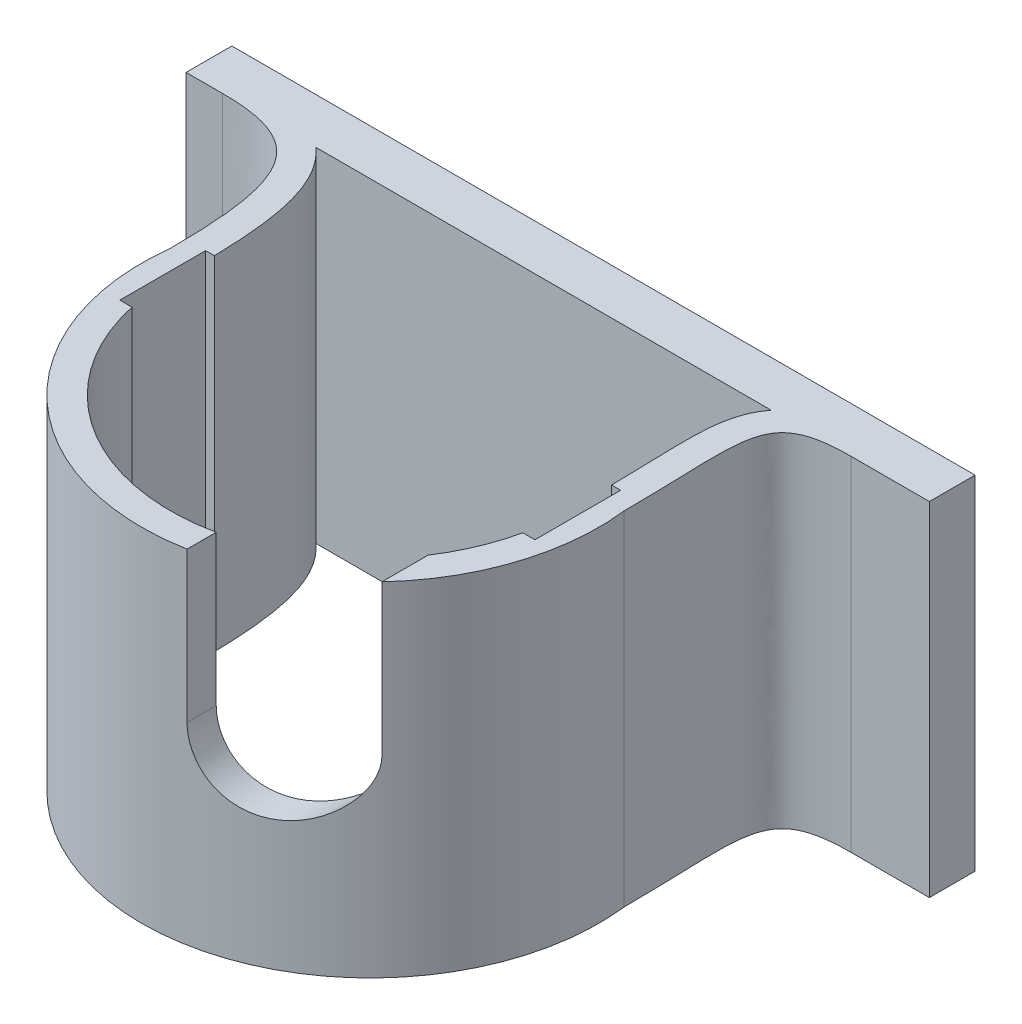
from build123d import *

# Parameters (mm, degrees)
BOSS_EXTRUDE2_START     = -30
BOSS_EXTRUDE2_DEPTH     = 60
CUT_EXTRUDE1_DEPTH      = 30
CUT_EXTRUDE1_DEPTH_BACK = 12
SKETCH2_W               = 72.600000086
SKETCH2_H               = 15
CUT_EXTRUDE2_REACH      = 109.943
CUT_EXTRUDE2_END_RADIUS = 35


# Read off the part's stored shape, not the designer's step: Boss-Extrude2
with BuildPart() as part:
    # Boss-Extrude2 outline → Boss-Extrude2 (new body)
    with BuildSketch(Plane(origin=(0, 0, 0), x_dir=(1, 0, 0), z_dir=(0, 1, 0)).offset(BOSS_EXTRUDE2_START)):
        with BuildLine():
            Line((-65, 40.788), (-65, 32.788))
            Line((-65, 32.788), (-58.6640897, 32.788))
            add(Edge.make_bspline(
                [(-39.726875088, 4.666411438), (-39.726875088, 26.333078105), (-43.6640897, 32.788), (-58.6640897, 32.788)],
                knots=[0, 0, 0, 0, 1, 1, 1, 1], degree=3))
            ThreePointArc((-39.726875088, 4.666411438), (0, -40), (39.726875088, 4.666411438))
            add(Edge.make_bspline(
                [(39.726875088, 4.666411438), (39.726875088, 26.333078105), (36.335782116, 32.788), (51.335782116, 32.788)],
                knots=[0, 0, 0, 0, 1, 1, 1, 1], degree=3))
            Line((51.335782116, 32.788), (65, 32.788))
            Line((65, 32.788), (65, 40.788))
            Line((65, 40.788), (-65, 40.788))
        make_face()
        with BuildLine():
            add(Edge.make_bspline(
                [(37.322321234, 32.787999997), (37.214983937, 32.6492714), (36.601118756, 31.814611367), (35.73171702, 30.172599558), (34.800229832, 27.122418367), (34.414470427, 23.259382738), (34.438742851, 18.930468379), (34.548064386, 14.993063003), (34.641903468, 11.772708701), (34.703941427, 8.845933226), (34.725133622, 6.653478096), (34.72929314, 5.367067617), (34.727774909, 4.696007075), (34.726875088, 4.363959967)],
                knots=[0.359345427, 0.359345427, 0.359345427, 0.359345427, 0.372091813, 0.434882632, 0.49767345, 0.623255088, 0.748836725, 0.811627544, 0.874418363, 0.937209181, 0.968604591, 0.984302295, 1, 1, 1, 1], degree=3))
            ThreePointArc((34.726875088, 4.363959967), (0, -35), (-34.726875088, 4.363959967))
            add(Edge.make_bspline(
                [(-34.726875088, 4.363959967), (-34.729305052, 5.049007951), (-34.738428611, 6.435574708), (-34.793206082, 9.076539579), (-34.927377092, 12.195031477), (-35.211190541, 15.649676256), (-35.779016422, 19.912389182), (-36.900687517, 24.659444132), (-39.068630657, 29.318190534), (-41.204796111, 31.813713357), (-42.298121026, 32.787999997)],
                knots=[-0.0046531, -0.0046531, -0.0046531, -0.0046531, 0.02674231, 0.058137719, 0.120928538, 0.183719357, 0.246510175, 0.372091813, 0.49767345, 0.601270914, 0.601270914, 0.601270914, 0.601270914], degree=3))
            Line((-42.298121026, 32.787999997), (37.322321234, 32.787999997))
        make_face(mode=Mode.SUBTRACT)
    extrude(amount=BOSS_EXTRUDE2_DEPTH)

    # Sketch2 → Cut-Extrude1 (cut, two sides: drawn at the far end of the back side and taken through both)
    with BuildSketch(Plane(origin=(0, 0, 0), x_dir=(1, 0, 0), z_dir=(0, 1, 0)).offset(-CUT_EXTRUDE1_DEPTH_BACK)):
        Rectangle(SKETCH2_W, SKETCH2_H)
    extrude(amount=CUT_EXTRUDE1_DEPTH + CUT_EXTRUDE1_DEPTH_BACK, mode=Mode.SUBTRACT)

    # Cut-Extrude2: up to this cylinder (the profile starts outside it)
    cut_extrude2_end = Plane(origin=(0, 12.467931, 0), z_dir=(0, -1, 0)) * Cylinder(CUT_EXTRUDE2_END_RADIUS, 290.886, mode=Mode.PRIVATE)
    # Sketch4 → Cut-Extrude2 (cut, up to the surface)
    with BuildSketch(Plane.XY.offset(40), mode=Mode.PRIVATE) as cut_extrude2_sk1:
        with BuildLine():
            Line((7.288, 30), (7.288, 3.748))
            ThreePointArc((7.288, 3.748), (18.288, -7.252), (29.288, 3.748))
            Line((29.288, 3.748), (29.288, 30))
            Line((29.288, 30), (7.288, 30))
        make_face()
    cut_extrude2_tool1 = extrude(cut_extrude2_sk1.sketch, amount=-CUT_EXTRUDE2_REACH, mode=Mode.PRIVATE) - cut_extrude2_end
    add(cut_extrude2_tool1.solids().sort_by_distance((18.288, 12.467931, 40))[0], mode=Mode.SUBTRACT)


solid = part.part
